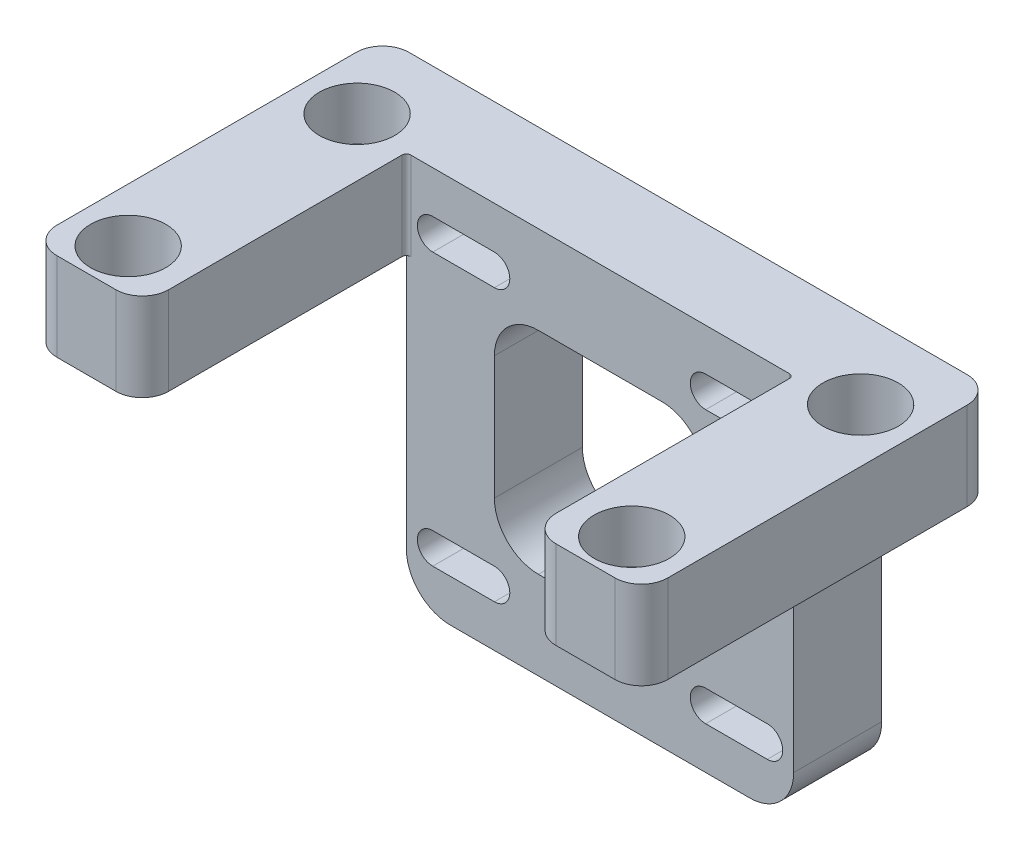
from build123d import *

# Parameters (mm, degrees)
SKETCH1_W           = 44
SKETCH1_H           = 44
BOSS_EXTRUDE1_DEPTH = 10
BOSS_EXTRUDE2_DEPTH = 12.7
SKETCH3_R           = 2.6
CUT_EXTRUDE1_DEPTH  = 63.929245983
SKETCH4_R           = 4.275
CUT_EXTRUDE2_DEPTH  = 66.177373375
FILLET1_R           = 3
FILLET2_R           = 5
FILLET3_R           = 0.5


with BuildPart() as part:
    # Sketch1 → Boss-Extrude1 (new body)
    with BuildSketch(Plane.XY):
        Rectangle(SKETCH1_W, SKETCH1_H)
        with BuildLine():
            Line((7, 12), (-7, 12))
            ThreePointArc((-7, 12), (-10.535533906, 10.535533906), (-12, 7))
            Line((-12, 7), (-12, -7))
            ThreePointArc((-12, -7), (-10.535533906, -10.535533906), (-7, -12))
            Line((-7, -12), (7, -12))
            ThreePointArc((7, -12), (10.535533906, -10.535533906), (12, -7))
            Line((12, -7), (12, 7))
            ThreePointArc((12, 7), (10.535533906, 10.535533906), (7, 12))
        make_face(mode=Mode.SUBTRACT)
        with BuildLine():
            Line((-19, 17.2), (-12, 17.2))
            ThreePointArc((-12, 17.2), (-10.25, 15.45), (-12, 13.7))
            Line((-12, 13.7), (-19, 13.7))
            ThreePointArc((-19, 13.7), (-20.75, 15.45), (-19, 17.2))
        make_face(mode=Mode.SUBTRACT)
        with BuildLine():
            Line((-19, -17.2), (-12, -17.2))
            ThreePointArc((-12, -17.2), (-10.25, -15.45), (-12, -13.7))
            Line((-12, -13.7), (-19, -13.7))
            ThreePointArc((-19, -13.7), (-20.75, -15.45), (-19, -17.2))
        make_face(mode=Mode.SUBTRACT)
        with BuildLine():
            Line((12, 17.2), (19, 17.2))
            ThreePointArc((19, 17.2), (20.75, 15.45), (19, 13.7))
            Line((19, 13.7), (12, 13.7))
            ThreePointArc((12, 13.7), (10.25, 15.45), (12, 17.2))
        make_face(mode=Mode.SUBTRACT)
        with BuildLine():
            Line((12, -13.7), (19, -13.7))
            ThreePointArc((19, -13.7), (20.75, -15.45), (19, -17.2))
            Line((19, -17.2), (12, -17.2))
            ThreePointArc((12, -17.2), (10.25, -15.45), (12, -13.7))
        make_face(mode=Mode.SUBTRACT)
    extrude(amount=BOSS_EXTRUDE1_DEPTH)

    # Sketch2 → Boss-Extrude2 (add)
    with BuildSketch(Plane(origin=(22, 0, 0), x_dir=(0, 0, -1), z_dir=(1, 0, 0))):
        Polygon((0, 12), (-40, 12), (-40, 16), (-40, 22), (-10, 22), (0, 22), align=None)
    boss_extrude2 = extrude(amount=BOSS_EXTRUDE2_DEPTH)

    # Sketch3 → Cut-Extrude1 (cut, through all)
    with BuildSketch(Plane.XZ.offset(-12)):
        with Locations((28.6, 35)):
            Circle(SKETCH3_R)
        with Locations((28.6, 9)):
            Circle(SKETCH3_R)
    cut_extrude1 = extrude(amount=-CUT_EXTRUDE1_DEPTH, mode=Mode.SUBTRACT)

    # Sketch4 → Cut-Extrude2 (cut, through all)
    with BuildSketch(Plane(origin=(0, 16, 0), x_dir=(-1, 0, 0), z_dir=(0, -1, 0))):
        with Locations((-28.6, -9)):
            Circle(SKETCH4_R)
        with Locations((-28.6, -35)):
            Circle(SKETCH4_R)
    cut_extrude2 = extrude(amount=-CUT_EXTRUDE2_DEPTH, mode=Mode.SUBTRACT)

    # Mirror1: Boss-Extrude2, Cut-Extrude1, Cut-Extrude2 across plane
    add(boss_extrude2.mirror(Plane(origin=(0, 0, 0), x_dir=(0, 0, 1), z_dir=(1, 0, 0))))
    add(cut_extrude1.mirror(Plane(origin=(0, 0, 0), x_dir=(0, 0, 1), z_dir=(1, 0, 0))), mode=Mode.SUBTRACT)
    add(cut_extrude2.mirror(Plane(origin=(0, 0, 0), x_dir=(0, 0, 1), z_dir=(1, 0, 0))), mode=Mode.SUBTRACT)

    # Fillet1
    fillet1_edges = [part.edges().sort_by_distance(p)[0] for p in [
        (34.7, 17, 0),
        (-34.7, 17, 0),
        (34.7, 17, 40),
        (22, 17, 40),
        (-22, 17, 40),
        (-34.7, 17, 40),
    ]]
    fillet(fillet1_edges, radius=FILLET1_R)

    # Fillet2
    fillet2_edges = [part.edges().sort_by_distance(p)[0] for p in [
        (22, -22, 5),
        (-22, -22, 5),
    ]]
    fillet(fillet2_edges, radius=FILLET2_R)

    # Fillet3
    fillet3_edges = [part.edges().sort_by_distance(p)[0] for p in [
        (-22, 17, 10),
        (22, 17, 10),
    ]]
    fillet(fillet3_edges, radius=FILLET3_R)


solid = part.part
